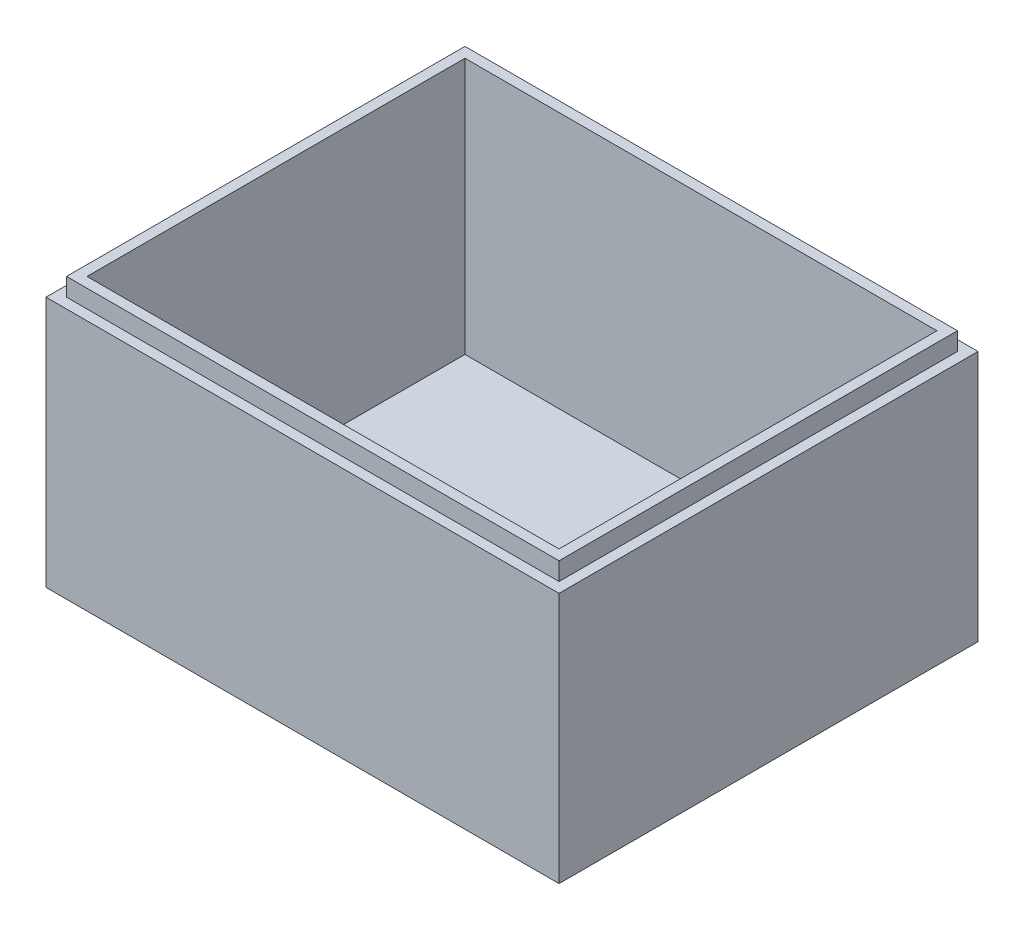
from build123d import *

# Parameters (mm, degrees)
BATTERYANDOUTERWALLS_W   = 60
BATTERYANDOUTERWALLS_H   = 49
BATTERYANDOUTERWALLS_W_2 = 55.2
BATTERYANDOUTERWALLS_H_2 = 44.2
WALLS_DEPTH              = 30
SKETCH2_W                = 60
SKETCH2_H                = 49
BOTTOM_DEPTH             = 1.5
SINKRIM_W                = 60
SINKRIM_H                = 49
SINKRIM_W_2              = 57.6
SINKRIM_H_2              = 46.6
TOP_CUT_DEPTH            = 2.1
BOSS_EXTRUDE2_DEPTH      = 60


with BuildPart() as part:
    # BatteryAndOuterWalls → Walls (new body)
    with BuildSketch(Plane(origin=(0, 0, 0), x_dir=(1, 0, 0), z_dir=(0, 1, 0))):
        Rectangle(BATTERYANDOUTERWALLS_W, BATTERYANDOUTERWALLS_H)
        Rectangle(BATTERYANDOUTERWALLS_W_2, BATTERYANDOUTERWALLS_H_2, mode=Mode.SUBTRACT)
    extrude(amount=WALLS_DEPTH)

    # Sketch2 → Bottom (add)
    with BuildSketch(Plane.XZ):
        Rectangle(SKETCH2_W, SKETCH2_H)
    extrude(amount=BOTTOM_DEPTH)

    # SinkRim → Top-Cut (cut)
    with BuildSketch(Plane(origin=(0, 30, 0), x_dir=(1, 0, 0), z_dir=(0, 1, 0))):
        Rectangle(SINKRIM_W, SINKRIM_H)
        Rectangle(SINKRIM_W_2, SINKRIM_H_2, mode=Mode.SUBTRACT)
    extrude(amount=-TOP_CUT_DEPTH, mode=Mode.SUBTRACT)

    # FrontRail → Boss-Extrude2 (add)
    with BuildSketch(Plane(origin=(30, 0, 0), x_dir=(0, 0, -1), z_dir=(1, 0, 0))):
        with BuildLine():
            Line((-19.1, 15), (-22.1, 15))
            Line((-22.1, 15), (-22.1, 13))
            ThreePointArc((-22.1, 13), (-20.892838828, 13.741380952), (-19.5, 14))
            ThreePointArc((-19.5, 14), (-19.217157288, 14.117157288), (-19.1, 14.4))
            Line((-19.1, 14.4), (-19.1, 15))
        make_face()
    extrude(amount=-BOSS_EXTRUDE2_DEPTH)


solid = part.part
